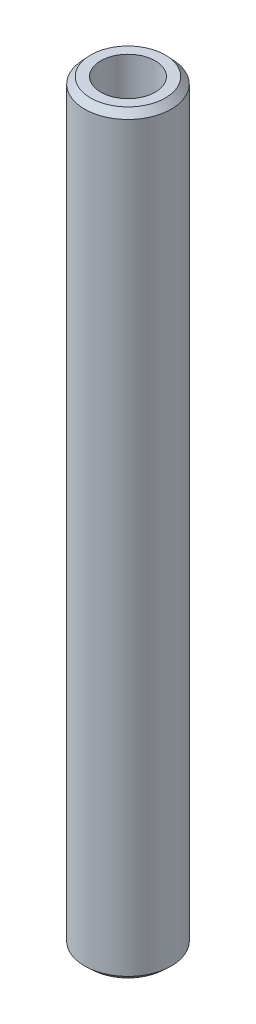
from build123d import *
from OCP.BRepFilletAPI import BRepFilletAPI_MakeChamfer

# Parameters (mm, degrees)
SKETCH1_R           = 7.5
BOSS_EXTRUDE1_DEPTH = 130.495948498
SKETCH2_R           = 4.707867551
CUT_EXTRUDE1_DEPTH  = 131.926286797
CHAMFER1_SIZE       = 1.142097773
CHAMFER1_SIZE2      = 1.047465362


with BuildPart() as part:
    # Sketch1 → Boss-Extrude1 (new body)
    with BuildSketch(Plane(origin=(0, 0, 0), x_dir=(1, 0, 0), z_dir=(0, 1, 0))):
        Circle(SKETCH1_R)
    extrude(amount=BOSS_EXTRUDE1_DEPTH)

    # Sketch2 → Cut-Extrude1 (cut, through all)
    with BuildSketch(Plane(origin=(0, 0, 0), x_dir=(1, 0, 0), z_dir=(0, 1, 0))):
        Circle(SKETCH2_R)
    extrude(amount=CUT_EXTRUDE1_DEPTH, mode=Mode.SUBTRACT)

    # Chamfer1: one chamfer whose edges measure the first distance from different faces: ONE call of the kernel's chamfer builder (chamfer() names one face for all edges)
    chamfer1_edges_1 = [part.edges().sort_by_distance(p)[0] for p in [
        (-7.5, 130.495948498, 0),
    ]]
    chamfer1_side_1 = [part.faces().sort_by_distance(p)[0] for p in [
        (-7.5, 65.247974249, 0),
    ]]
    chamfer1_edges_2 = [part.edges().sort_by_distance(p)[0] for p in [
        (-7.5, 0, 0),
    ]]
    chamfer1_side_2 = [part.faces().sort_by_distance(p)[0] for p in [
        (-7.287867966, 0, 0),
    ]]
    chamfer1 = BRepFilletAPI_MakeChamfer(part.part.solid().wrapped)
    for e in chamfer1_edges_1:
        chamfer1.Add(CHAMFER1_SIZE, CHAMFER1_SIZE2, e.wrapped, chamfer1_side_1[0].wrapped)  # the first distance lies on this face
    for e in chamfer1_edges_2:
        chamfer1.Add(CHAMFER1_SIZE, CHAMFER1_SIZE2, e.wrapped, chamfer1_side_2[0].wrapped)  # the first distance lies on this face
    add(Compound.cast(chamfer1.Shape()), mode=Mode.REPLACE)


solid = part.part
